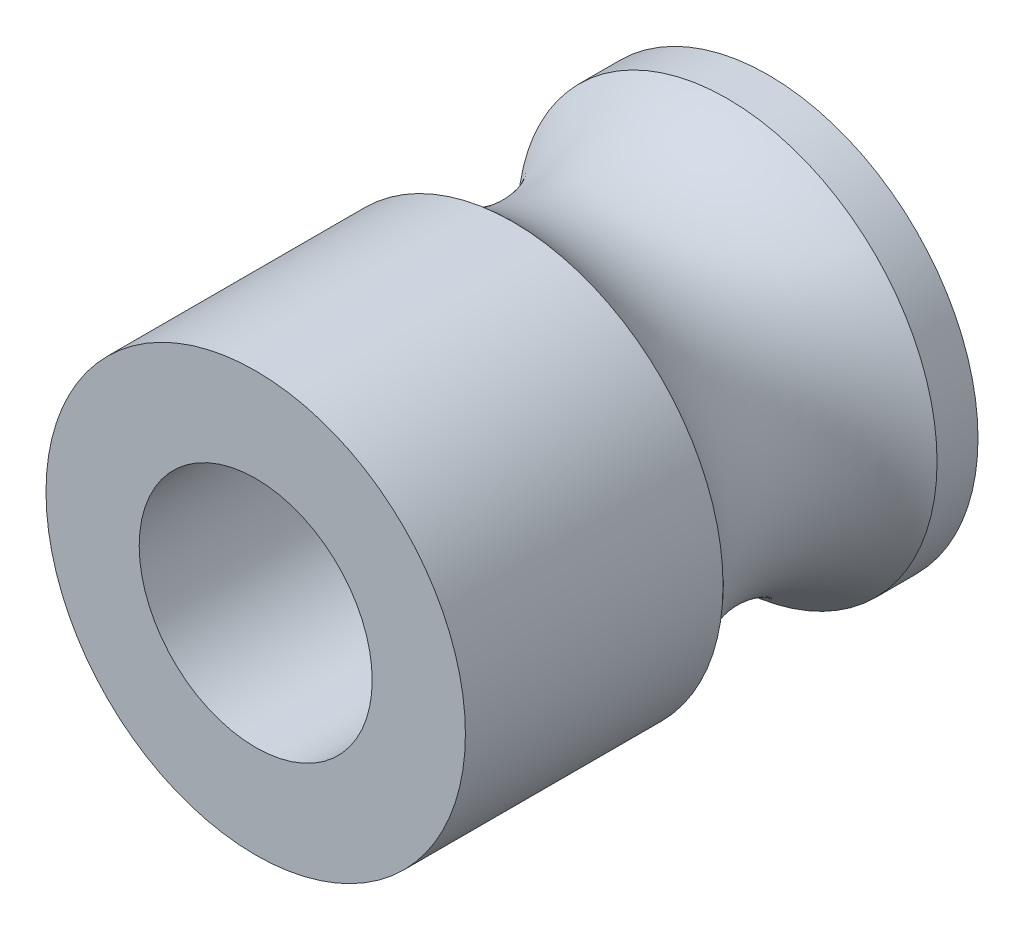
from build123d import *

# Parameters (mm, degrees)
F_5_0_5_DIAMETER_HOLE1_D = 5


with BuildPart() as part:
    # Sketch1 → Revolve1 (revolve)
    with BuildSketch(Plane(origin=(0, 0, 0), x_dir=(1, 0, 0), z_dir=(0, 1, 0))):
        with BuildLine():
            Line((4.5, 0), (0, 0))
            Line((0, 0), (0, -11))
            Line((0, -11), (4.5, -11))
            Line((4.5, -11), (4.5, -5.471192501))
            ThreePointArc((4.5, -5.471192501), (3.55, -3.175), (4.5, -0.878807499))
            Line((4.5, -0.878807499), (4.5, 0))
        make_face()
    revolve(axis=Axis((0, 0, 0), (0, 0, 1)))

    # Ø5.0 (5) Diameter Hole1 (through all)
    with Locations(Plane.XY.offset(11)):
        with Locations((0, 0)):
            Hole(F_5_0_5_DIAMETER_HOLE1_D / 2)


solid = part.part
